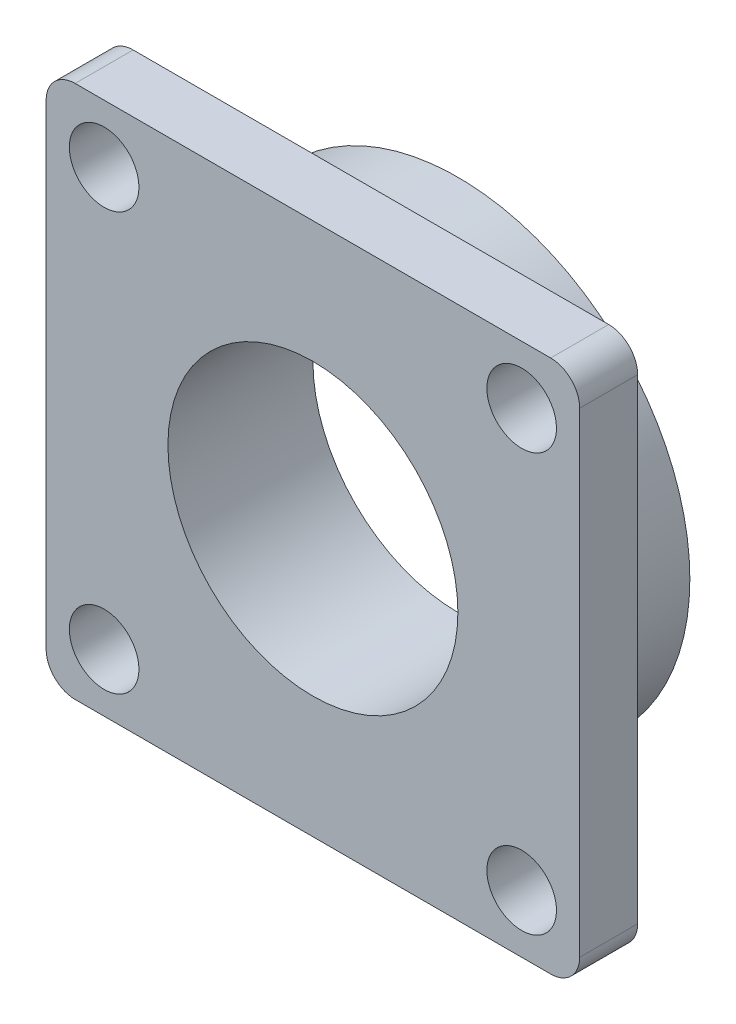
from build123d import *

# Parameters (mm, degrees)
ESQUISSE1_R        = 40
ESQUISSE1_R_2      = 25
BOSS_EXTRU_1_DEPTH = 25
BOSS_EXTRU_2_START = -10
ESQUISSE4_R        = 6
ESQUISSE4_R_2      = 25
BOSS_EXTRU_2_DEPTH = 10
CONG_1_R           = 5


with BuildPart() as part:
    # Esquisse1 → Boss.-Extru.1 (new body)
    with BuildSketch(Plane.XY):
        Circle(ESQUISSE1_R)
        Circle(ESQUISSE1_R_2, mode=Mode.SUBTRACT)
    extrude(amount=BOSS_EXTRU_1_DEPTH)

    # Esquisse4 → Boss.-Extru.2 (add)
    with BuildSketch(Plane.XY.offset(25).offset(BOSS_EXTRU_2_START)):
        with BuildLine():
            Line((41, 46), (-41, 46))
            ThreePointArc((-41, 46), (-44.535533906, 44.535533906), (-46, 41))
            Line((-46, 41), (-46, -41))
            ThreePointArc((-46, -41), (-44.535533906, -44.535533906), (-41, -46))
            Line((-41, -46), (41, -46))
            ThreePointArc((41, -46), (44.535533906, -44.535533906), (46, -41))
            Line((46, -41), (46, 41))
            ThreePointArc((46, 41), (44.535533906, 44.535533906), (41, 46))
        make_face()
        with Locations((-36, 36)):
            Circle(ESQUISSE4_R, mode=Mode.SUBTRACT)
        with Locations((-36, -36)):
            Circle(ESQUISSE4_R, mode=Mode.SUBTRACT)
        with Locations(Location((36, -36, 0), (0, 0, 180))):
            Circle(ESQUISSE4_R, mode=Mode.SUBTRACT)
        with Locations(Location((36, 36, 0), (0, 0, 180))):
            Circle(ESQUISSE4_R, mode=Mode.SUBTRACT)
        Circle(ESQUISSE4_R_2, mode=Mode.SUBTRACT)
    extrude(amount=BOSS_EXTRU_2_DEPTH)

    # Congé1
    # the kernel refuses this fillet: 5 mm, written as the material it adds along each edge
    with BuildSketch(Plane(origin=(0, 0, 15), x_dir=(1, 0, 0), z_dir=(0, 1, 0))) as cong_1_piece_1_section:
        with BuildLine():
            CenterArc((40 + CONG_1_R, CONG_1_R), CONG_1_R, 180, 90)
            Line((40 + CONG_1_R, 0), (40, 0))
            Line((40, 0), (40, CONG_1_R))
        make_face()
    cong_1_piece_1 = revolve(axis=Axis((0, 0, 15), (0, 0, -1)), mode=Mode.PRIVATE)
    cong_1_piece_1 = cong_1_piece_1 - Plane(origin=(36, 36, 13.61437319), x_dir=(-1, 0, 0), z_dir=(0, 0, -1)) * Cylinder(6, 180, mode=Mode.PRIVATE)
    cong_1_piece_1 = cong_1_piece_1 - Plane(origin=(-36, 36, 13.61437319), x_dir=(1, 0, 0), z_dir=(0, 0, -1)) * Cylinder(6, 180, mode=Mode.PRIVATE)
    cong_1_piece_1 = cong_1_piece_1 - Plane(origin=(36, -36, 13.61437319), x_dir=(-1, 0, 0), z_dir=(0, 0, -1)) * Cylinder(6, 180, mode=Mode.PRIVATE)
    cong_1_piece_1 = cong_1_piece_1 - Plane(origin=(-36, -36, 13.61437319), x_dir=(1, 0, 0), z_dir=(0, 0, -1)) * Cylinder(6, 180, mode=Mode.PRIVATE)
    add(cong_1_piece_1)


solid = part.part
